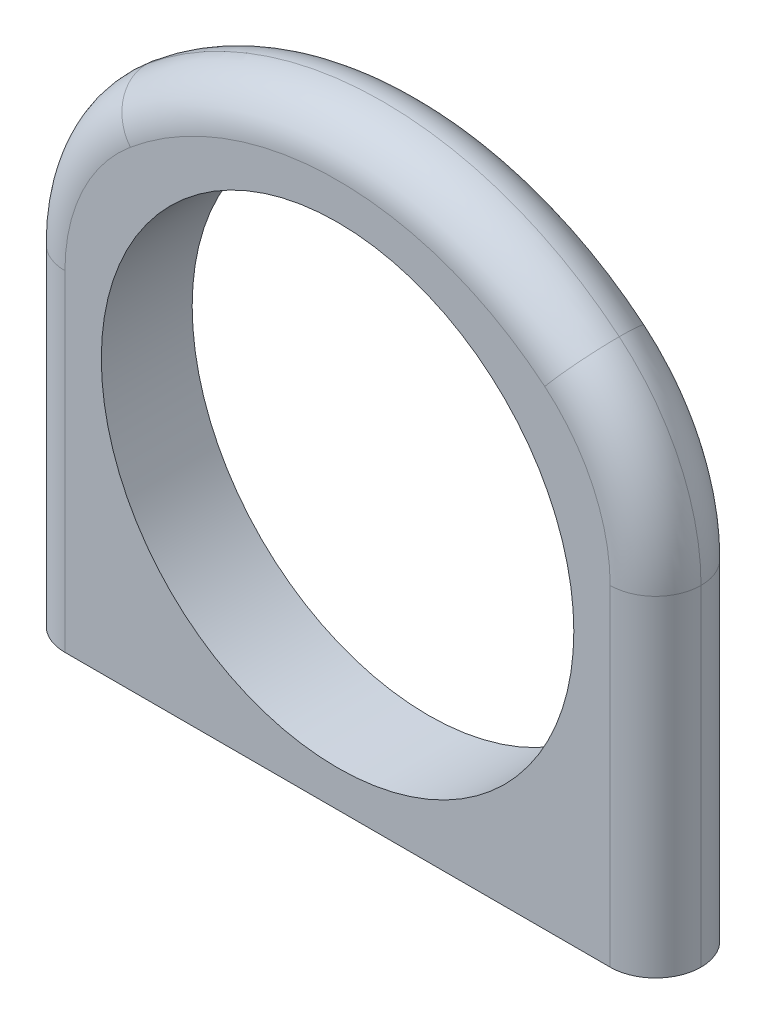
from build123d import *

# Parameters (mm, degrees)
SKETCH2_R           = 26
BOSS_EXTRUDE1_DEPTH = 5
FILLET3_R           = 25
SKETCH9_R           = 2
CUT_EXTRUDE2_DEPTH  = 4
FILLET5_R           = 5


with BuildPart() as part:
    # Sketch2 → Boss-Extrude1 (new, symmetric)
    with BuildSketch(Plane.XY):
        with BuildLine():
            Line((-35, 15), (-35, -30))
            Line((-35, -30), (35, -30))
            Line((35, -30), (35, 15))
            ThreePointArc((35, 15), (0, 35), (-35, 15))
        make_face()
        Circle(SKETCH2_R, mode=Mode.SUBTRACT)
    extrude(amount=BOSS_EXTRUDE1_DEPTH, both=True)

    # Fillet3
    fillet3_edges = [part.edges().sort_by_distance(p)[0] for p in [
        (35, 15, 0),
        (-35, 15, 0),
    ]]
    fillet(fillet3_edges, radius=FILLET3_R)

    # Sketch9 → Cut-Extrude2 (cut)
    with BuildSketch(Plane.XZ.offset(30)):
        with Locations(Location((-7.5, 0, 0), (0, 0, 270))):
            Circle(SKETCH9_R)
        with Locations(Location((7.5, 0, 0), (0, 0, 270))):
            Circle(SKETCH9_R)
    extrude(amount=-CUT_EXTRUDE2_DEPTH, mode=Mode.SUBTRACT)

    # Fillet5
    fillet5_edges = [part.edges().sort_by_distance(p)[0] for p in [
        (-35, -11.809571027, 5),
        (-35, -11.809571027, -5),
        (-32.638462845, 16.987459663, 5),
        (-32.638462845, 16.987459663, -5),
        (35, -11.809571027, -5),
        (35, -11.809571027, 5),
        (32.638462845, 16.987459663, 5),
        (32.638462845, 16.987459663, -5),
        (0, 35, 5),
        (0, 35, -5),
    ]]
    fillet(fillet5_edges, radius=FILLET5_R - 0.0001)  # a hair under: the kernel refuses the full size


solid = part.part
